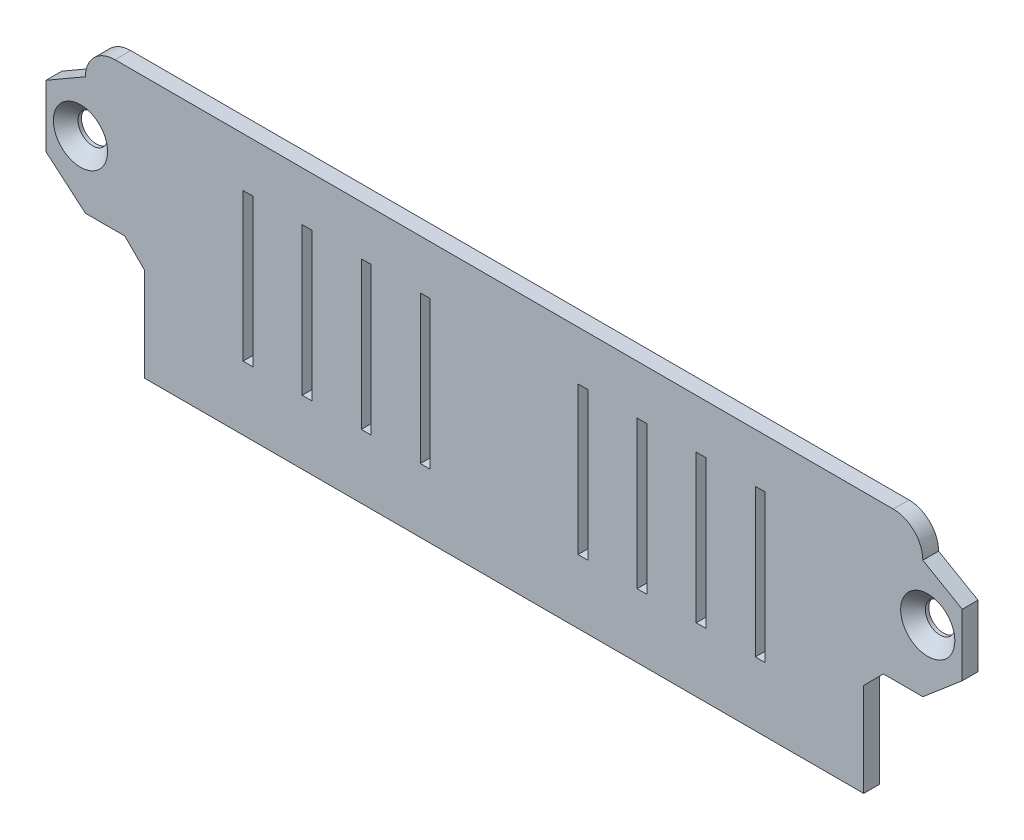
from build123d import *

# Parameters (mm, degrees)
SKETCH1_R                   = 1.5
BOSS_EXTRUDE1_DEPTH         = 1.6
FILLET1_R                   = 3
FILLET2_R                   = 3
SKETCH2_R                   = 2.75
SCREW_HEADS_DEPTH           = 2
SCREW_HEADS_DRAFT           = -45
SCREW_HEADS_PROFILE_2_DEPTH = 2
SCREW_HEADS_PROFILE_2_DRAFT = -45
SKETCH3_W                   = 1
SKETCH3_H                   = 15
AIR_VENTS_DEPTH             = 2


with BuildPart() as part:
    # Sketch1 → Boss-Extrude1 (new body)
    with BuildSketch(Plane.XY):
        Polygon((-42.5, 43.777330307), (42.5, 43.777330307), (42.5, 40.777330307), (46.5, 38.467511309), (46.5, 32.177265409), (42.5, 28.777330307), (38.5, 28.777330307), (36.5, 26.777330307), (36.5, 17.277330307), (-36.5, 17.277330307), (-36.5, 26.777330307), (-38.5, 28.777330307), (-42.5, 28.777330307), (-46.5, 32.177265409), (-46.5, 38.467511309), (-42.5, 40.777330307), align=None)
        with Locations((-43, 35.322388359)):
            Circle(SKETCH1_R, mode=Mode.SUBTRACT)
        with Locations(Location((43, 35.322388359, 0), (0, 0, 180))):
            Circle(SKETCH1_R, mode=Mode.SUBTRACT)
    extrude(amount=BOSS_EXTRUDE1_DEPTH)

    # Fillet1
    fillet1_edges = [part.edges().sort_by_distance(p)[0] for p in [
        (42.5, 43.777330307, 0.8),
    ]]
    fillet(fillet1_edges, radius=FILLET1_R - 0.0001)  # a hair under: the kernel refuses the full size

    # Fillet2
    fillet2_edges = [part.edges().sort_by_distance(p)[0] for p in [
        (-42.5, 43.777330307, 0.8),
    ]]
    fillet(fillet2_edges, radius=FILLET2_R - 0.0001)  # a hair under: the kernel refuses the full size


with BuildPart() as screw_heads_tool:
    # Sketch2 → Screw Heads (with draft: the straight prism first)
    with BuildSketch(Plane.XY.offset(1.6)):
        with Locations((-43, 35.322388359)):
            Circle(SKETCH2_R)
    extrude(amount=-SCREW_HEADS_DEPTH)
    # Screw Heads: the draft: its side faces are tilted about the plane it starts from
    screw_heads_sides = [screw_heads_tool.faces().sort_by_distance(p)[0] for p in [
        (-45.75, 35.322388359, 0.6),
    ]]
    draft(screw_heads_sides, Plane.XY.offset(1.6), SCREW_HEADS_DRAFT)


with BuildPart() as part_1:
    add(part.part)

    # Screw Heads: cut by screw_heads_tool
    add(screw_heads_tool.part, mode=Mode.SUBTRACT)


with BuildPart() as screw_heads_profile_2_tool:
    # Sketch2 → Screw Heads profile 2 (with draft: the straight prism first)
    with BuildSketch(Plane.XY.offset(1.6)):
        with Locations((43, 35.322388359)):
            Circle(SKETCH2_R)
    extrude(amount=-SCREW_HEADS_PROFILE_2_DEPTH)
    # Screw Heads profile 2: the draft: its side faces are tilted about the plane it starts from
    screw_heads_profile_2_sides = [screw_heads_profile_2_tool.faces().sort_by_distance(p)[0] for p in [
        (40.25, 35.322388359, 0.6),
    ]]
    draft(screw_heads_profile_2_sides, Plane.XY.offset(1.6), SCREW_HEADS_PROFILE_2_DRAFT)


with BuildPart() as part_2:
    add(part_1.part)

    # Screw Heads profile 2: cut by screw_heads_profile_2_tool
    add(screw_heads_profile_2_tool.part, mode=Mode.SUBTRACT)

    # Sketch3 → Air Vents (cut)
    with BuildSketch(Plane.XY.offset(1.6)):
        with Locations((-26, 31.277330307)):
            Rectangle(SKETCH3_W, SKETCH3_H)
        with Locations((-20, 31.277330307)):
            Rectangle(SKETCH3_W, SKETCH3_H)
        with Locations((-14, 31.277330307)):
            Rectangle(SKETCH3_W, SKETCH3_H)
        with Locations((-8, 31.277330307)):
            Rectangle(SKETCH3_W, SKETCH3_H)
        with Locations((8, 31.277330307)):
            Rectangle(SKETCH3_W, SKETCH3_H)
        with Locations((14, 31.277330307)):
            Rectangle(SKETCH3_W, SKETCH3_H)
        with Locations((20, 31.277330307)):
            Rectangle(SKETCH3_W, SKETCH3_H)
        with Locations((26, 31.277330307)):
            Rectangle(SKETCH3_W, SKETCH3_H)
    extrude(amount=-AIR_VENTS_DEPTH, mode=Mode.SUBTRACT)


solid = part_2.part
